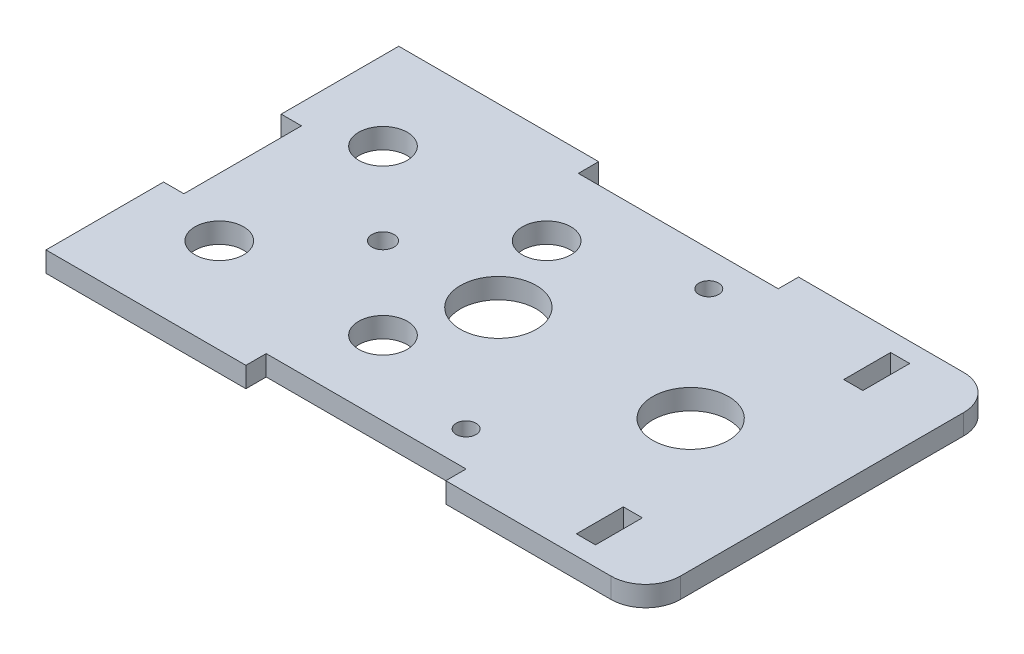
from build123d import *

# Parameters (mm, degrees)
SKETCH1_W           = 172.72
SKETCH1_H           = 101.6
BOSS_EXTRUDE1_DEPTH = 5.85
SKETCH2_R           = 10.935
SKETCH2_R_2         = 3.175
SKETCH2_R_3         = 7
CUT_EXTRUDE4_DEPTH  = 10
SKETCH4_W           = 5.85
SKETCH4_H           = 33.866666666
SKETCH4_W_2         = 57.573333334
SKETCH4_H_2         = 5.85
SKETCH4_W_3         = 5.5
SKETCH4_H_3         = 13.5
CUT_EXTRUDE5_DEPTH  = 10
FILLET1_R           = 10
FILLET2_R           = 10
SKETCH5_R           = 2.85
CUT_EXTRUDE6_DEPTH  = 10


with BuildPart() as part:
    # Sketch1 → Boss-Extrude1 (new body)
    with BuildSketch(Plane(origin=(0, 0, 0), x_dir=(1, 0, 0), z_dir=(0, 1, 0))):
        Rectangle(SKETCH1_W, SKETCH1_H)
    extrude(amount=BOSS_EXTRUDE1_DEPTH)

    # Sketch2 → Cut-Extrude4 (cut)
    with BuildSketch(Plane(origin=(0, 0, 0), x_dir=(1, 0, 0), z_dir=(0, 1, 0))):
        with Locations((-6.8720506, 0)):
            Circle(SKETCH2_R)
        with Locations((-40.10375, 0)):
            Circle(SKETCH2_R_2)
        with Locations((-63.676922318, 23.573172318)):
            Circle(SKETCH2_R_3)
        with Locations((-16.530577682, 23.573172318)):
            Circle(SKETCH2_R_3)
        with Locations((-63.676922318, -23.573172318)):
            Circle(SKETCH2_R_3)
        with Locations((-16.530577682, -23.573172318)):
            Circle(SKETCH2_R_3)
        with Locations((48.5139194, 0)):
            Circle(SKETCH2_R)
    extrude(amount=CUT_EXTRUDE4_DEPTH, mode=Mode.SUBTRACT)

    # Sketch4 → Cut-Extrude5 (cut)
    with BuildSketch(Plane(origin=(0, 5.85, 0), x_dir=(1, 0, 0), z_dir=(0, 1, 0))):
        with Locations((-83.435, 0)):
            Rectangle(SKETCH4_W, SKETCH4_H)
        with Locations((0, -47.875)):
            Rectangle(SKETCH4_W_2, SKETCH4_H_2)
        with Locations((0, 47.875)):
            Rectangle(SKETCH4_W_2, SKETCH4_H_2)
        with Locations((63.61, -38.5)):
            Rectangle(SKETCH4_W_3, SKETCH4_H_3)
        with Locations((63.61, 38.5)):
            Rectangle(SKETCH4_W_3, SKETCH4_H_3)
    extrude(amount=-CUT_EXTRUDE5_DEPTH, mode=Mode.SUBTRACT)

    # Fillet1
    fillet1_edges = [part.edges().sort_by_distance(p)[0] for p in [
        (86.36, 2.925, -50.8),
    ]]
    fillet(fillet1_edges, radius=FILLET1_R)

    # Fillet2
    fillet2_edges = [part.edges().sort_by_distance(p)[0] for p in [
        (86.36, 2.925, 50.8),
    ]]
    fillet(fillet2_edges, radius=FILLET2_R)

    # Sketch5 → Cut-Extrude6 (cut)
    with BuildSketch(Plane(origin=(0, 5.85, 0), x_dir=(1, 0, 0), z_dir=(0, 1, 0))):
        with Locations((18.786666667, -34.95)):
            Circle(SKETCH5_R)
        with Locations((18.786666667, 34.95)):
            Circle(SKETCH5_R)
    extrude(amount=-CUT_EXTRUDE6_DEPTH, mode=Mode.SUBTRACT)


solid = part.part
